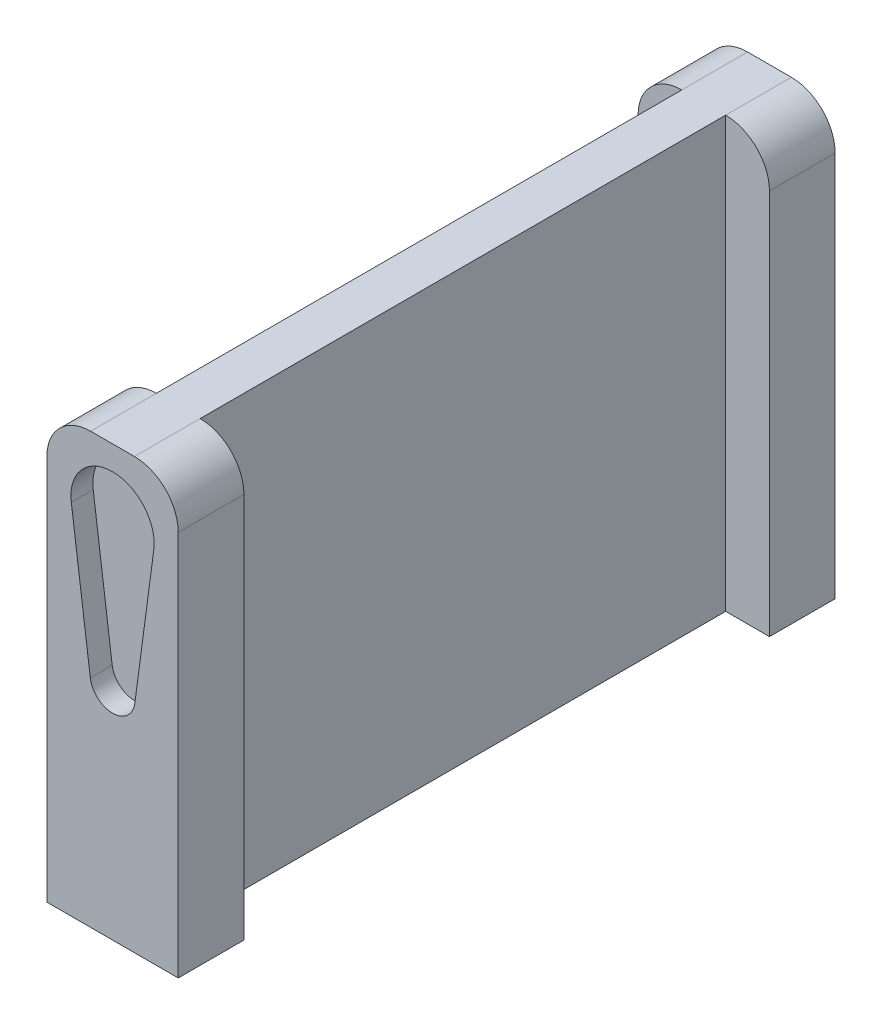
from build123d import *

# Parameters (mm, degrees)
BOSS_EXTRUDE2_DEPTH = 39.25
CUT_EXTRUDE1_DEPTH  = 2
FILLET1_R           = 4


with BuildPart() as part:
    # Sketch4 → Boss-Extrude2 (new body)
    with BuildSketch(Plane(origin=(0, 6, 0), x_dir=(1, 0, 0), z_dir=(0, 1, 0))):
        Polygon((-6, 30), (6, 30), (6, 24), (2, 24), (2, -24), (6, -24), (6, -30), (-6, -30), (-6, -24), (-2, -24), (-2, 24), (-6, 24), align=None)
    extrude(amount=-BOSS_EXTRUDE2_DEPTH)

    # Sketch5 → Cut-Extrude1 (cut)
    with BuildSketch(Plane.XY.offset(30)):
        with BuildLine():
            Line((3.76671072, -0.501886792), (2.032041309, -13.520754717))
            ThreePointArc((2.032041309, -13.520754717), (0, -15.3), (-2.032041309, -13.520754717))
            Line((-2.032041309, -13.520754717), (-3.76671072, -0.501886792))
            ThreePointArc((-3.76671072, -0.501886792), (0, 3.8), (3.76671072, -0.501886792))
        make_face()
    cut_extrude1 = extrude(amount=-CUT_EXTRUDE1_DEPTH, mode=Mode.SUBTRACT)

    # Mirror1: Cut-Extrude1 across plane
    add(cut_extrude1.mirror(Plane.XY), mode=Mode.SUBTRACT)

    # Fillet1
    fillet1_edges = [part.edges().sort_by_distance(p)[0] for p in [
        (-6, 6, -27),
        (6, 6, -27),
        (6, 6, 27),
        (-6, 6, 27),
    ]]
    fillet(fillet1_edges, radius=FILLET1_R)


solid = part.part
